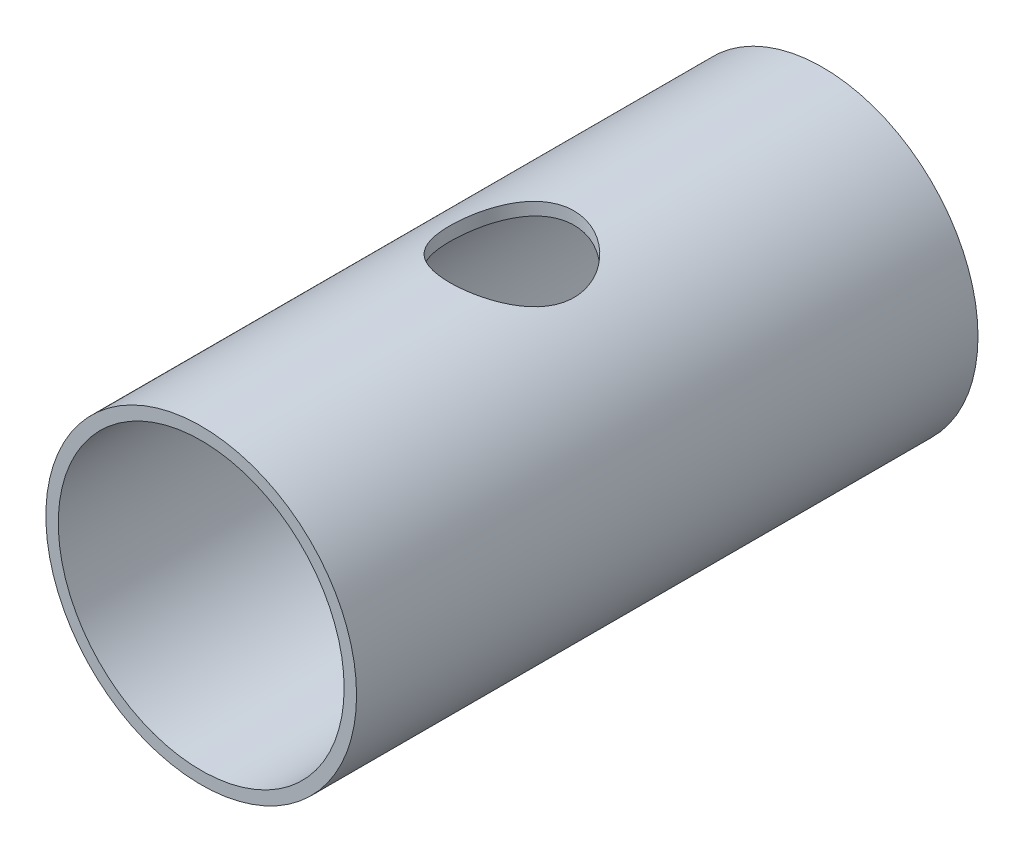
from build123d import *

# Parameters (mm, degrees)
SKETCH1_R               = 12.5
SKETCH1_R_2             = 11.5
BOSS_EXTRUDE1_DEPTH     = 50
CUT_EXTRUDE1_DEPTH      = 54.033008589
CUT_EXTRUDE1_DEPTH_BACK = 54.033008589
SKETCH2_R               = 5


with BuildPart() as part:
    # Sketch1 → Boss-Extrude1 (new body)
    with BuildSketch(Plane.XY):
        Circle(SKETCH1_R)
        Circle(SKETCH1_R_2, mode=Mode.SUBTRACT)
    extrude(amount=BOSS_EXTRUDE1_DEPTH)

    # Sketch2 → Cut-Extrude1 (cut, two sides: drawn at the far end of the back side and taken through both)
    with BuildSketch(Plane(origin=(0, 0, 0), x_dir=(1, 0, 0), z_dir=(0, 1, 0)).offset(-CUT_EXTRUDE1_DEPTH_BACK)):
        with Locations((0, -25)):
            Circle(SKETCH2_R)
    extrude(amount=CUT_EXTRUDE1_DEPTH + CUT_EXTRUDE1_DEPTH_BACK, mode=Mode.SUBTRACT)


solid = part.part
